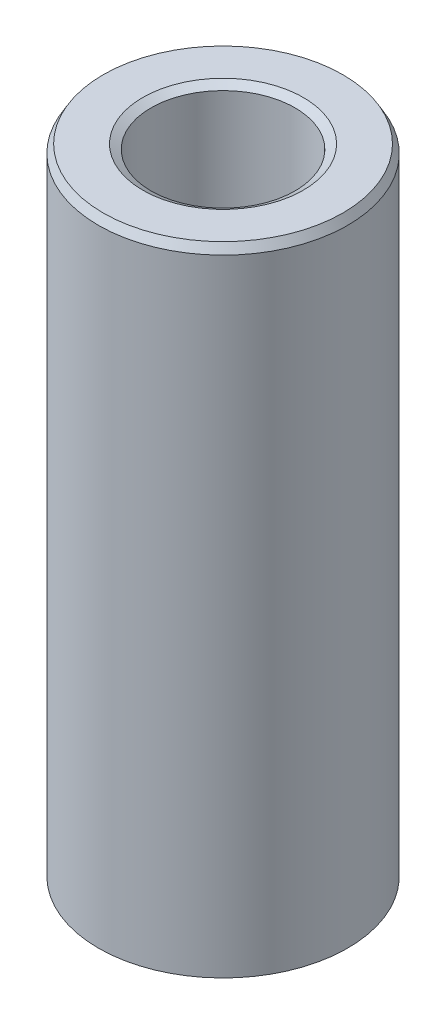
from build123d import *
from OCP.BRepFilletAPI import BRepFilletAPI_MakeChamfer

# Parameters (mm, degrees)
SKETCH1_R           = 17.5
BOSS_EXTRUDE1_DEPTH = 89.751824345
SKETCH2_R           = 10.115077403
CUT_EXTRUDE1_DEPTH  = 94.101503603
CHAMFER1_SIZE       = 1.165367316
CHAMFER1_SIZE2      = 0.672825134


with BuildPart() as part:
    # Sketch1 → Boss-Extrude1 (new body)
    with BuildSketch(Plane(origin=(0, 0, 0), x_dir=(1, 0, 0), z_dir=(0, 1, 0))):
        Circle(SKETCH1_R)
    extrude(amount=BOSS_EXTRUDE1_DEPTH)

    # Sketch2 → Cut-Extrude1 (cut, through all)
    with BuildSketch(Plane(origin=(0, 0, 0), x_dir=(1, 0, 0), z_dir=(0, 1, 0))):
        Circle(SKETCH2_R)
    extrude(amount=CUT_EXTRUDE1_DEPTH, mode=Mode.SUBTRACT)

    # Chamfer1: one chamfer whose edges measure the first distance from different faces: ONE call of the kernel's chamfer builder (chamfer() names one face for all edges)
    chamfer1_edges_1 = [part.edges().sort_by_distance(p)[0] for p in [
        (-10.115077403, 89.751824345, 0),
    ]]
    chamfer1_side_1 = [part.faces().sort_by_distance(p)[0] for p in [
        (-17.005025253, 89.751824345, 0),
    ]]
    chamfer1_edges_2 = [part.edges().sort_by_distance(p)[0] for p in [
        (-10.115077403, 0, 0),
    ]]
    chamfer1_side_2 = [part.faces().sort_by_distance(p)[0] for p in [
        (-10.115077403, 44.875912172, 0),
    ]]
    chamfer1_edges_3 = [part.edges().sort_by_distance(p)[0] for p in [
        (-17.5, 0, 0),
    ]]
    chamfer1_side_3 = [part.faces().sort_by_distance(p)[0] for p in [
        (-17.005025253, 0, 0),
    ]]
    chamfer1_edges_4 = [part.edges().sort_by_distance(p)[0] for p in [
        (-17.5, 89.751824345, 0),
    ]]
    chamfer1_side_4 = [part.faces().sort_by_distance(p)[0] for p in [
        (-17.5, 44.875912172, 0),
    ]]
    chamfer1 = BRepFilletAPI_MakeChamfer(part.part.solid().wrapped)
    for e in chamfer1_edges_1:
        chamfer1.Add(CHAMFER1_SIZE, CHAMFER1_SIZE2, e.wrapped, chamfer1_side_1[0].wrapped)  # the first distance lies on this face
    for e in chamfer1_edges_2:
        chamfer1.Add(CHAMFER1_SIZE, CHAMFER1_SIZE2, e.wrapped, chamfer1_side_2[0].wrapped)  # the first distance lies on this face
    for e in chamfer1_edges_3:
        chamfer1.Add(CHAMFER1_SIZE, CHAMFER1_SIZE2, e.wrapped, chamfer1_side_3[0].wrapped)  # the first distance lies on this face
    for e in chamfer1_edges_4:
        chamfer1.Add(CHAMFER1_SIZE, CHAMFER1_SIZE2, e.wrapped, chamfer1_side_4[0].wrapped)  # the first distance lies on this face
    add(Compound.cast(chamfer1.Shape()), mode=Mode.REPLACE)


solid = part.part
